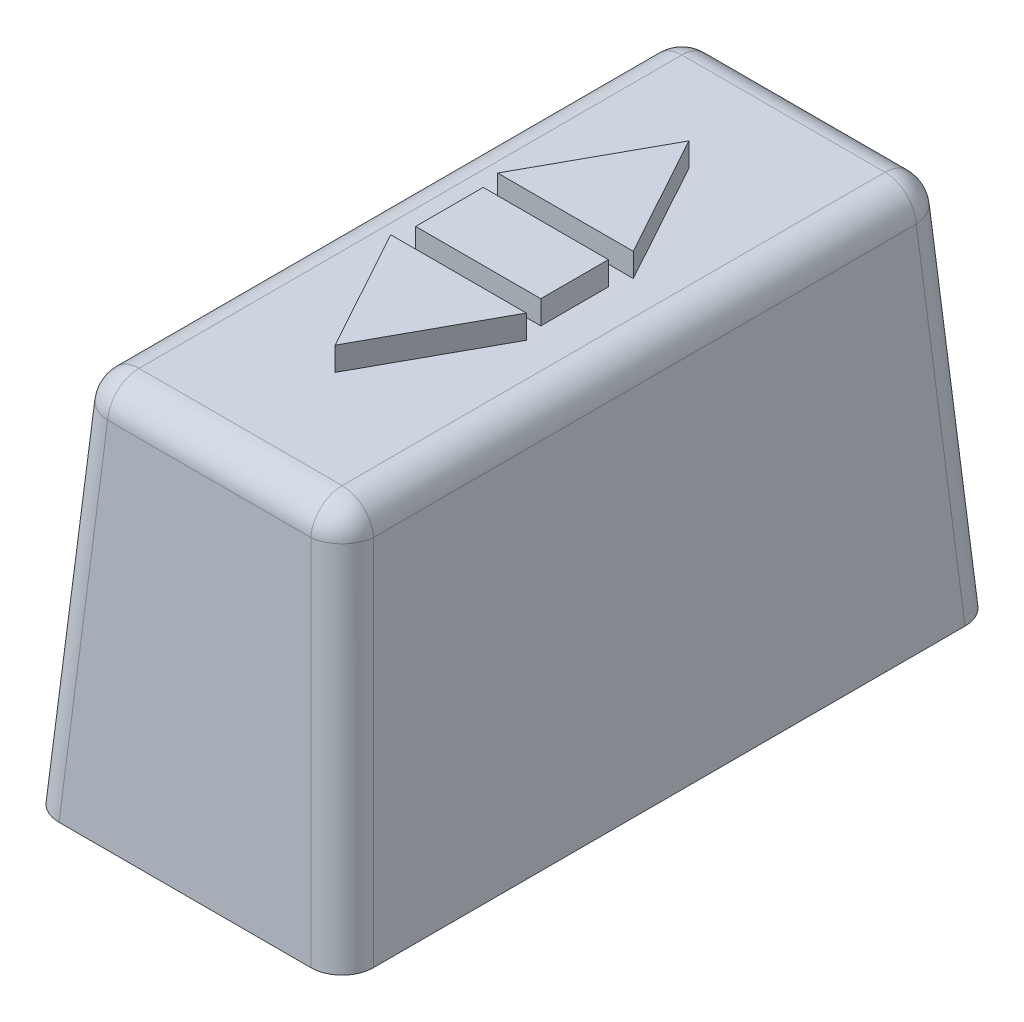
from build123d import *

# Parameters (mm, degrees)
SKETCH1_W           = 40
SKETCH1_H           = 83.2
SKETCH1_W_2         = 15.916627574
SKETCH1_H_2         = 8.6
BOSS_EXTRUDE1_DEPTH = 48
CHAMFER1_SIZE       = 48
CHAMFER1_SIZE_2     = 3.356486973
BOSS_EXTRUDE2_START = 48
SKETCH1_3_W         = 15.916627574
SKETCH1_3_H         = 8.6
BOSS_EXTRUDE2_DEPTH = 3
FILLET1_R           = 4


with BuildPart() as part:
    # Sketch1 → Boss-Extrude1 (new body)
    # profile 1 of 4: a face of its own
    with BuildSketch(Plane(origin=(0, 0, 0), x_dir=(1, 0, 0), z_dir=(0, 1, 0))):
        Rectangle(SKETCH1_W, SKETCH1_H)
        Polygon((8.620526076, 6.8), (0, 22.5), (-8.620526076, 6.8), align=None, mode=Mode.SUBTRACT)
        Rectangle(SKETCH1_W_2, SKETCH1_H_2, mode=Mode.SUBTRACT)
        Polygon((-8.620526076, -6.8), (0, -22.5), (8.620526076, -6.8), align=None, mode=Mode.SUBTRACT)
    # profile 2 of 4: a face of its own
    with BuildSketch(Plane(origin=(0, 0, 0), x_dir=(1, 0, 0), z_dir=(0, 1, 0))):
        Polygon((-8.620526076, 6.8), (8.620526076, 6.8), (0, 22.5), align=None)
    # profile 3 of 4: a face of its own
    with BuildSketch(Plane(origin=(0, 0, 0), x_dir=(1, 0, 0), z_dir=(0, 1, 0))):
        Rectangle(SKETCH1_W_2, SKETCH1_H_2)
    # profile 4 of 4: a face of its own
    with BuildSketch(Plane(origin=(0, 0, 0), x_dir=(1, 0, 0), z_dir=(0, 1, 0))):
        Polygon((-8.620526076, -6.8), (8.620526076, -6.8), (0, -22.5), align=None)
    extrude(amount=BOSS_EXTRUDE1_DEPTH)

    # Chamfer1
    # the kernel refuses this chamfer: 48, 3.356486973 mm, written as the material it takes off along each edge
    with BuildSketch(Plane(origin=(144.788756649, 48, 41.6), x_dir=(0, -0.999996400257939, 0.002683183028377395), z_dir=(-1, 0, 0)), Plane(origin=(-144.788756649, 48, -41.6), x_dir=(0, -0.999996400257939, -0.002683183028377395), z_dir=(1, 0, 0))) as chamfer1_piece_1:
        Polygon((CHAMFER1_SIZE * 0.999996400258, -CHAMFER1_SIZE * 0.00268318302838), (-CHAMFER1_SIZE_2 * 0.00268318302861, -CHAMFER1_SIZE_2 * 0.999996400344), (0, 0), align=None)
    extrude(amount=289.577513297, mode=Mode.SUBTRACT)
    with BuildSketch(Plane(origin=(-20, 48, 166.388756649), x_dir=(0.8766829747338886, 0.4810685624853697, 0), z_dir=(0, 0, -1))) as chamfer1_piece_2:
        Polygon((CHAMFER1_SIZE_2 * 0.876682974809, CHAMFER1_SIZE_2 * 0.481068562527), (-CHAMFER1_SIZE * 0.481068562485, CHAMFER1_SIZE * 0.876682974734), (0, 0), align=None)
    extrude(amount=332.777513297, mode=Mode.SUBTRACT)
    with BuildSketch(Plane(origin=(20, 48, -166.388756649), x_dir=(0.002683183028377466, -0.999996400257939, 0), z_dir=(0, 0, 1))) as chamfer1_piece_3:
        Polygon((CHAMFER1_SIZE * 0.999996400258, -CHAMFER1_SIZE * 0.00268318302838), (-CHAMFER1_SIZE_2 * 0.00268318302861, -CHAMFER1_SIZE_2 * 0.999996400344), (0, 0), align=None)
    extrude(amount=332.777513297, mode=Mode.SUBTRACT)

    # Sketch1<3> → Boss-Extrude2 (add)
    with BuildSketch(Plane(origin=(0, 0, 0), x_dir=(1, 0, 0), z_dir=(0, 1, 0)).offset(BOSS_EXTRUDE2_START)):
        Polygon((-8.620526076, 6.8), (8.620526076, 6.8), (0, 22.5), align=None)
        Rectangle(SKETCH1_3_W, SKETCH1_3_H)
        Polygon((-8.620526076, -6.8), (8.620526076, -6.8), (0, -22.5), align=None)
    extrude(amount=BOSS_EXTRUDE2_DEPTH)

    # Fillet1
    fillet1_edges = [part.edges().sort_by_distance(p)[0] for p in [
        (16.643513027, 48, 0),
        (0, 48, -38.243513027),
        (-16.643513027, 48, 0),
        (0, 48, 38.243513027),
        (-18.321756513, 24, -39.921756513),
        (18.321756513, 24, -39.921756513),
        (-18.321756513, 24, 39.921756513),
        (18.321756513, 24, 39.921756513),
    ]]
    fillet(fillet1_edges, radius=FILLET1_R)


solid = part.part
